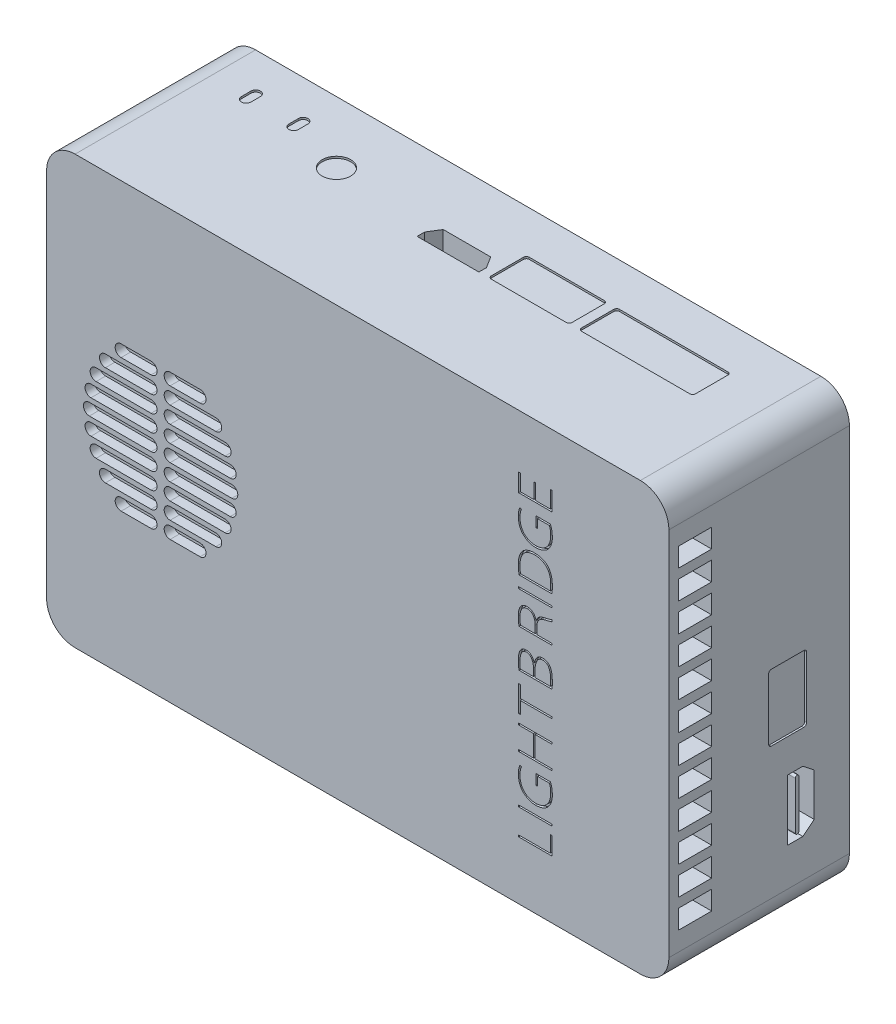
from build123d import *

# Parameters (mm, degrees)
MAIN_P_DEPTH         = 9.5
N3_LED_P_START       = -0.3
N3_LED_P_OUTLINE_W   = 3.5
N3_LED_P_OUTLINE_H   = 0.176423458
N3_LED_P_OUTLINE_H_2 = 0.176423459
N3_LED_P_DEPTH       = 0.3
CUT_EXTRUDE_1_DEPTH  = 1
ANTENNA_R            = 1.75
ANTENNA_R_2          = 1.25
CUT_EXTRUDE_2_DEPTH  = 0.2
SKETCH_7_3_R         = 1.25
CUT_EXTRUDE_3_DEPTH  = 3
AIT_TUBE_W           = 3.5
AIT_TUBE_H           = 2
CUT_EXTRUDE_4_DEPTH  = 40
CUT_EXTRUDE_START    = -5
CUT_EXTRUDE_5_DEPTH  = 5
CUT_EXTRUDE_START_2  = -0.2
CUT_EXTRUDE_6_DEPTH  = 0.2
CUT_EXTRUDE_7_DEPTH  = 0.2
CUT_EXTRUDE_8_DEPTH  = 5
SKETCH_10_6_R        = 1.5
CUT_EXTRUDE_9_DEPTH  = 0.2


# Read off the part's stored shape, not the designer's step: N3_LED_P, 切除-拉伸5, 切除-拉伸6
with BuildPart() as part:
    # Main → Main_P (new, symmetric)
    with BuildSketch(Plane.XY):
        with BuildLine():
            Line((-32.75, 19.5), (-32.75, -19.5))
            ThreePointArc((-32.75, -19.5), (-31.871320344, -21.621320344), (-29.75, -22.5))
            Line((-29.75, -22.5), (29.75, -22.5))
            ThreePointArc((29.75, -22.5), (31.871320344, -21.621320344), (32.75, -19.5))
            Line((32.75, -19.5), (32.75, 19.5))
            ThreePointArc((32.75, 19.5), (31.871320344, 21.621320344), (29.75, 22.5))
            Line((29.75, 22.5), (-29.75, 22.5))
            ThreePointArc((-29.75, 22.5), (-31.871320344, 21.621320344), (-32.75, 19.5))
        make_face()
    extrude(amount=MAIN_P_DEPTH, both=True)

    # N3_LED_P outline → N3_LED_P (cut)
    # profile 1 of 11: a face of its own
    with BuildSketch(Plane.XY.offset(9.5).offset(N3_LED_P_START)):
        with BuildLine():
            add(Edge.make_bspline(
                [(20.001928554, 11.353160073), (20.043677538, 11.401957467), (20.12563917, 11.49775654), (20.230328225, 11.652385483), (20.314454199, 11.813297479), (20.380551722, 11.979569559), (20.428182555, 12.151098568), (20.46286017, 12.327033268), (20.482093262, 12.508005578), (20.483996653, 12.630285047), (20.484957009, 12.691981212)],
                knots=[0, 0, 0, 0, 0.131993441, 0.259129603, 0.383023191, 0.504727587, 0.626369442, 0.74859247, 0.87315221, 1, 1, 1, 1], degree=3))
            add(Edge.make_bspline(
                [(20.484957009, 12.691981212), (20.483221419, 12.758407255), (20.479894688, 12.88573085), (20.465033479, 13.068364915), (20.442386428, 13.234608939), (20.409947285, 13.382873255), (20.375025678, 13.512615428), (20.341438151, 13.622348552), (20.30944645, 13.711816633), (20.285167186, 13.762758724), (20.274387903, 13.78537552)],
                knots=[0, 0, 0, 0, 0.17769931, 0.340609104, 0.489860893, 0.626074063, 0.7462279, 0.849140392, 0.933022753, 1, 1, 1, 1], degree=3))
            Line((20.274387903, 13.78537552), (18.764862846, 13.786086208))
            Line((18.764862846, 13.786086208), (18.764862846, 12.70724536))
            Line((18.764862846, 12.70724536), (18.93696313, 12.70724536))
            Line((18.93696313, 12.70724536), (18.93696313, 13.609662749))
            Line((18.93696313, 13.609662749), (20.162120829, 13.609662749))
            add(Edge.make_bspline(
                [(20.162120829, 13.609662749), (20.172968992, 13.587807743), (20.196033344, 13.541341665), (20.222888906, 13.463013366), (20.247444009, 13.373823335), (20.270783012, 13.272908982), (20.28856455, 13.159021643), (20.303067994, 13.031855972), (20.31114195, 12.891031731), (20.312699893, 12.792532479), (20.313513919, 12.741066577)],
                knots=[0, 0, 0, 0, 0.082268436, 0.174911484, 0.278790538, 0.394495802, 0.524216016, 0.667557628, 0.82629872, 1, 1, 1, 1], degree=3))
            add(Edge.make_bspline(
                [(20.313513919, 12.741066577), (20.311172733, 12.676025688), (20.306604605, 12.549117771), (20.283591235, 12.364763116), (20.248361465, 12.191385425), (20.199599452, 12.029435115), (20.136705205, 11.879082185), (20.060807254, 11.740161491), (19.972694476, 11.61185104), (19.870209155, 11.496580427), (19.757502163, 11.39341834), (19.634717877, 11.3041968), (19.504131774, 11.227066859), (19.363771462, 11.165849199), (19.215502641, 11.115633922), (19.057889011, 11.082039761), (18.89190718, 11.058754201), (18.778198859, 11.055860301), (18.720017985, 11.054379585)],
                knots=[0, 0, 0, 0, 0.074561748, 0.145485034, 0.21264214, 0.277120648, 0.339000405, 0.399080334, 0.458259166, 0.516984465, 0.575465895, 0.633030831, 0.690641939, 0.748920315, 0.808219462, 0.869738904, 0.933349605, 1, 1, 1, 1], degree=3))
            add(Edge.make_bspline(
                [(18.720017985, 11.054379585), (18.662564303, 11.055974297), (18.549864958, 11.059102432), (18.384882195, 11.080965701), (18.227139258, 11.115672362), (18.076628998, 11.164675482), (17.933733801, 11.228353392), (17.798466316, 11.305716064), (17.670473762, 11.396652963), (17.550262336, 11.500680316), (17.441096661, 11.618997269), (17.345405688, 11.750540535), (17.263752672, 11.894999648), (17.196188039, 12.052197812), (17.142866506, 12.222439761), (17.10440906, 12.405431718), (17.078183334, 12.600922274), (17.07299195, 12.73576381), (17.070322863, 12.805090968)],
                knots=[0, 0, 0, 0, 0.063634574, 0.124823592, 0.184029591, 0.242343714, 0.299846982, 0.357027756, 0.414680224, 0.473517376, 0.532818865, 0.592611097, 0.653311002, 0.716258734, 0.781807653, 0.850588601, 0.923181923, 1, 1, 1, 1], degree=3))
            add(Edge.make_bspline(
                [(17.070322863, 12.805090968), (17.071557095, 12.847797529), (17.073960056, 12.930944037), (17.084510663, 13.051662896), (17.097398235, 13.165247454), (17.115846778, 13.271442151), (17.139204532, 13.370258186), (17.166876303, 13.461533424), (17.198533841, 13.545462055), (17.224275507, 13.597283264), (17.236786277, 13.622469016)],
                knots=[0, 0, 0, 0, 0.152314901, 0.296545823, 0.431945517, 0.559836896, 0.680635867, 0.793779182, 0.899774116, 1, 1, 1, 1], degree=3))
            Line((17.236786277, 13.622469016), (17.070297158, 13.687117255))
            add(Edge.make_bspline(
                [(17.070297158, 13.687117255), (17.060682353, 13.668341971), (17.039152431, 13.626299475), (17.012719103, 13.552180293), (16.983759344, 13.46229129), (16.956985636, 13.356065448), (16.931500913, 13.236499357), (16.914762423, 13.104914464), (16.901992866, 12.963495151), (16.899939669, 12.86559042), (16.898879773, 12.815050317)],
                knots=[0, 0, 0, 0, 0.070576151, 0.158037419, 0.263017376, 0.386864239, 0.524695871, 0.672156233, 0.83076142, 1, 1, 1, 1], degree=3))
            add(Edge.make_bspline(
                [(16.898879773, 12.815050317), (16.900787459, 12.773541977), (16.904552145, 12.691628144), (16.914009265, 12.570974634), (16.929550617, 12.454588323), (16.947443923, 12.342433056), (16.970576764, 12.234794929), (16.996590342, 12.13139697), (17.027237712, 12.032384563), (17.062003974, 11.937574067), (17.101314246, 11.847260013), (17.143843841, 11.760822281), (17.190912566, 11.678869938), (17.242136167, 11.601098859), (17.297823848, 11.527946899), (17.356655239, 11.4585318), (17.420573873, 11.39432044), (17.509764088, 11.314890529), (17.625976171, 11.22488438), (17.770459251, 11.130733403), (17.918502801, 11.05126099), (18.06972369, 10.986047635), (18.22477805, 10.935891982), (18.383477834, 10.901340189), (18.545593567, 10.879645466), (18.654976492, 10.878049249), (18.710058635, 10.877245439)],
                knots=[0, 0, 0, 0, 0.041895112, 0.082677098, 0.121969993, 0.160253414, 0.197156967, 0.232935091, 0.267721705, 0.301609374, 0.334698209, 0.366988804, 0.398689845, 0.42992221, 0.460812283, 0.491334697, 0.521596622, 0.552074057, 0.611710228, 0.669602792, 0.725759705, 0.780917839, 0.835431765, 0.889786076, 0.944499389, 1, 1, 1, 1], degree=3))
            add(Edge.make_bspline(
                [(18.710058635, 10.877245439), (18.776529981, 10.878956607), (18.906810226, 10.882310404), (19.097626554, 10.906531586), (19.279572183, 10.944103057), (19.45097026, 10.998727853), (19.611511985, 11.065093131), (19.756750899, 11.147614955), (19.889050565, 11.241313601), (19.964453526, 11.316027504), (20.001928554, 11.353160073)],
                knots=[0, 0, 0, 0, 0.140972163, 0.27629782, 0.407409936, 0.534520343, 0.657372301, 0.775168028, 0.888259237, 1, 1, 1, 1], degree=3))
        make_face()
    # profile 2 of 11: a face of its own
    with BuildSketch(Plane.XY.offset(9.5).offset(N3_LED_P_START)):
        with BuildLine():
            add(Edge.make_bspline(
                [(17.460160261, 9.965253569), (17.437545455, 9.945440156), (17.392212587, 9.905722865), (17.329963143, 9.839824183), (17.271171926, 9.769997619), (17.217311893, 9.695124409), (17.167189919, 9.615901743), (17.121862726, 9.531868886), (17.080514957, 9.443516635), (17.043478914, 9.350330828), (17.010040201, 9.252866591), (16.981913851, 9.150310622), (16.956487096, 9.043699298), (16.937359854, 8.931904851), (16.920375029, 8.816005524), (16.909692746, 8.695333677), (16.901365894, 8.570104802), (16.899718753, 8.484881851), (16.898879773, 8.441473081)],
                knots=[0, 0, 0, 0, 0.053805333, 0.107856334, 0.162107056, 0.217137954, 0.27285245, 0.329844782, 0.387964543, 0.447409002, 0.509303087, 0.572345594, 0.637740232, 0.705447895, 0.775336706, 0.847408181, 0.922276534, 1, 1, 1, 1], degree=3))
            add(Edge.make_bspline(
                [(16.898879773, 8.441473081), (16.900608299, 8.354658739), (16.90394973, 8.186836994), (16.919215028, 7.944358849), (16.940611557, 7.719602383), (16.963831323, 7.576808855), (16.974997659, 7.508139748)],
                knots=[0, 0, 0, 0, 0.277855552, 0.537125578, 0.777404666, 1, 1, 1, 1], degree=3))
            Line((16.974997659, 7.508139748), (20.441563395, 7.508850435))
            add(Edge.make_bspline(
                [(20.441563395, 7.508850435), (20.449504706, 7.573528225), (20.465559536, 7.704286345), (20.478944939, 7.903965053), (20.486518437, 8.108722988), (20.485481531, 8.247022175), (20.484957009, 8.316981212)],
                knots=[0, 0, 0, 0, 0.241300813, 0.487834245, 0.740919499, 1, 1, 1, 1], degree=3))
            add(Edge.make_bspline(
                [(20.484957009, 8.316981212), (20.484392997, 8.362285585), (20.483281847, 8.451539022), (20.475038842, 8.582972045), (20.463336134, 8.709750123), (20.446249063, 8.831770749), (20.424124137, 8.948972371), (20.398049333, 9.061619276), (20.366842401, 9.169259311), (20.330267631, 9.271580199), (20.290525124, 9.369554961), (20.24656332, 9.462400912), (20.199012757, 9.550169061), (20.147246468, 9.632287153), (20.093002933, 9.710152171), (20.033457879, 9.781917072), (19.971066455, 9.849283539), (19.926111334, 9.890154463), (19.903757822, 9.910477146)],
                knots=[0, 0, 0, 0, 0.077753017, 0.153180001, 0.22595469, 0.296232891, 0.364561942, 0.430606773, 0.494618888, 0.556793227, 0.617029805, 0.676015949, 0.733021353, 0.788242289, 0.842557394, 0.895763282, 0.948169272, 1, 1, 1, 1], degree=3))
            add(Edge.make_bspline(
                [(19.903757822, 9.910477146), (19.853526049, 9.948337189), (19.754469389, 10.022996895), (19.595133586, 10.114278363), (19.43150942, 10.18799908), (19.26388407, 10.242108188), (19.095859551, 10.27990523), (18.930959065, 10.308664111), (18.769165571, 10.32385507), (18.662423525, 10.324764285), (18.609753757, 10.325212919)],
                knots=[0, 0, 0, 0, 0.136041375, 0.26827252, 0.396475576, 0.523892265, 0.648770483, 0.769014316, 0.886024647, 1, 1, 1, 1], degree=3))
            add(Edge.make_bspline(
                [(18.609753757, 10.325212919), (18.55424153, 10.324807738), (18.444896256, 10.324009633), (18.284144644, 10.309443328), (18.130297023, 10.280797202), (17.982461705, 10.243447473), (17.841709078, 10.191197231), (17.706996901, 10.129128006), (17.579053192, 10.053929664), (17.499955093, 9.994934478), (17.460160261, 9.965253569)],
                knots=[0, 0, 0, 0, 0.135479044, 0.266860004, 0.393341106, 0.517170538, 0.638578994, 0.759256684, 0.878880278, 1, 1, 1, 1], degree=3))
        make_face()
        with BuildLine():
            Line((20.277944814, 7.685273894), (17.135152421, 7.685273894))
            add(Edge.make_bspline(
                [(17.135152421, 7.685273894), (17.13043166, 7.707766445), (17.120529303, 7.754947243), (17.108829952, 7.829529957), (17.098155655, 7.910887335), (17.088834836, 7.99886843), (17.081992991, 8.093788252), (17.076386189, 8.19529423), (17.071871738, 8.303666312), (17.070849899, 8.37815535), (17.070322863, 8.416574707)],
                knots=[0, 0, 0, 0, 0.093749641, 0.196651009, 0.307886971, 0.428503945, 0.55753339, 0.696090129, 0.843251811, 1, 1, 1, 1], degree=3))
            add(Edge.make_bspline(
                [(17.070322863, 8.416574707), (17.07261469, 8.490860449), (17.07704069, 8.634321824), (17.100144563, 8.841368845), (17.134721962, 9.032676991), (17.184018713, 9.207561616), (17.244629694, 9.367147881), (17.319900479, 9.510056284), (17.40642546, 9.638524337), (17.508148413, 9.748847751), (17.618834296, 9.845446488), (17.738296598, 9.927993396), (17.865119629, 9.998492465), (17.999889296, 10.055366461), (18.142728077, 10.098977024), (18.293077165, 10.129069025), (18.451353655, 10.147643395), (18.559429775, 10.148401979), (18.614733432, 10.148790155)],
                knots=[0, 0, 0, 0, 0.084293615, 0.16278868, 0.236135431, 0.304614354, 0.368666143, 0.429438748, 0.487496489, 0.543870415, 0.599170997, 0.6538761, 0.708307954, 0.763524048, 0.8195218, 0.877455983, 0.937292973, 1, 1, 1, 1], degree=3))
            add(Edge.make_bspline(
                [(18.614733432, 10.148790155), (18.674305432, 10.148154534), (18.790913855, 10.146910347), (18.961991736, 10.127711311), (19.12531683, 10.09647265), (19.280350185, 10.049554731), (19.427952657, 9.990725294), (19.567465657, 9.917039473), (19.698462069, 9.828839305), (19.80134184, 9.745673839), (19.87827063, 9.671991283), (19.932393491, 9.612027124), (19.983023896, 9.547866977), (20.029803588, 9.479500065), (20.073461435, 9.407398385), (20.113280382, 9.331092016), (20.149556717, 9.250552591), (20.182292952, 9.16575802), (20.211214644, 9.076881996), (20.237209219, 8.984203185), (20.25799903, 8.887122811), (20.276781333, 8.786134394), (20.291502831, 8.680734525), (20.303067283, 8.571378214), (20.309848977, 8.457904175), (20.312277811, 8.381012267), (20.313513919, 8.341879585)],
                knots=[0, 0, 0, 0, 0.063336, 0.123976215, 0.182843069, 0.239981199, 0.296001009, 0.351627041, 0.407453443, 0.463747994, 0.492111995, 0.520684957, 0.549599897, 0.578985189, 0.608746969, 0.639209171, 0.670480405, 0.702661089, 0.735843385, 0.769868222, 0.804997091, 0.841410132, 0.879115073, 0.918168596, 0.958353455, 1, 1, 1, 1], degree=3))
            add(Edge.make_bspline(
                [(20.313513919, 8.341879585), (20.313635287, 8.277377607), (20.313866032, 8.154745847), (20.308670201, 7.980548835), (20.297184746, 7.825958127), (20.284067323, 7.730042267), (20.277944814, 7.685273894)],
                knots=[0, 0, 0, 0, 0.293955934, 0.558871746, 0.79410502, 1, 1, 1, 1], degree=3))
        make_face(mode=Mode.SUBTRACT)
    # profile 3 of 11: a face of its own
    with BuildSketch(Plane.XY.offset(9.5).offset(N3_LED_P_START)):
        with BuildLine():
            add(Edge.make_bspline(
                [(17.212599285, 4.802042187), (17.187625628, 4.772275863), (17.136691876, 4.711567472), (17.073473378, 4.606984446), (17.020766587, 4.490291562), (16.975081885, 4.361580854), (16.940615046, 4.217816664), (16.916257823, 4.05768591), (16.901437045, 3.880606736), (16.899756035, 3.756815107), (16.898879773, 3.69228609)],
                knots=[0, 0, 0, 0, 0.098739236, 0.201378586, 0.309623397, 0.424103807, 0.548328424, 0.685103007, 0.835853249, 1, 1, 1, 1], degree=3))
            add(Edge.make_bspline(
                [(16.898879773, 3.69228609), (16.89983384, 3.618513319), (16.901793072, 3.467016728), (16.915456659, 3.277329942), (16.930101181, 3.125146498), (16.943839781, 3.016811747), (16.958122177, 2.915089106), (16.97092094, 2.850198411), (16.977131806, 2.818708854)],
                knots=[0, 0, 0, 0, 0.251956012, 0.517406042, 0.649255179, 0.774128295, 0.890391064, 1, 1, 1, 1], degree=3))
            Line((16.977131806, 2.818708854), (20.441563395, 2.819419541))
            Line((20.441563395, 2.819419541), (20.441563395, 2.995843))
            Line((20.441563395, 2.995843), (18.84590622, 2.995843))
            Line((18.84590622, 2.995843), (18.84590622, 3.778137545))
            add(Edge.make_bspline(
                [(18.84590622, 3.778137545), (18.848144559, 3.810969691), (18.852499981, 3.874855388), (18.865190564, 3.967933453), (18.883968646, 4.055223656), (18.906206265, 4.137551711), (18.934863512, 4.214196677), (18.968900342, 4.285015557), (19.007577127, 4.35073499), (19.051870043, 4.410863585), (19.102161479, 4.465645789), (19.157201565, 4.51686745), (19.219028009, 4.563031755), (19.286204281, 4.605639172), (19.359727665, 4.643443786), (19.438597346, 4.677496676), (19.523431255, 4.707551967), (19.582568577, 4.723474806), (19.612802537, 4.731615358)],
                knots=[0, 0, 0, 0, 0.074062976, 0.144113783, 0.211217007, 0.274931514, 0.335904118, 0.395110606, 0.451590903, 0.507317097, 0.5628615, 0.618766345, 0.676306084, 0.73627992, 0.79763448, 0.862184157, 0.929541641, 1, 1, 1, 1], degree=3))
            add(Edge.make_bspline(
                [(19.612802537, 4.731615358), (19.664251153, 4.744925744), (19.762860468, 4.77043718), (19.90402436, 4.806432652), (20.031746019, 4.839508733), (20.145539132, 4.868098425), (20.244118448, 4.894080913), (20.325982987, 4.917710101), (20.390356802, 4.940107417), (20.426694198, 4.956000351), (20.442274082, 4.962814545)],
                knots=[0, 0, 0, 0, 0.184989652, 0.354561589, 0.507116897, 0.644254874, 0.762986854, 0.86197473, 0.940820809, 1, 1, 1, 1], degree=3))
            Line((20.442274082, 4.962814545), (20.441563395, 5.17738587))
            add(Edge.make_bspline(
                [(20.441563395, 5.17738587), (20.422821668, 5.16567292), (20.381472594, 5.139831137), (20.30801055, 5.107421461), (20.219991431, 5.075098545), (20.136499438, 5.049329918), (20.061315515, 5.028353173), (19.997277776, 5.011310392), (19.927342012, 4.993441442), (19.851418512, 4.975106312), (19.769623997, 4.955826271), (19.68199913, 4.936216652), (19.588800768, 4.914316951), (19.52438413, 4.900788724), (19.491156196, 4.89381048)],
                knots=[0, 0, 0, 0, 0.066505769, 0.146728843, 0.241202307, 0.348969302, 0.409803661, 0.476338617, 0.548583434, 0.627239274, 0.711619263, 0.80172784, 0.897725578, 1, 1, 1, 1], degree=3))
            add(Edge.make_bspline(
                [(19.491156196, 4.89381048), (19.448361585, 4.882042936), (19.364662665, 4.859027637), (19.246876812, 4.807418712), (19.138945359, 4.744705486), (19.040818159, 4.670817803), (18.954916311, 4.584822585), (18.881651523, 4.488197948), (18.822253559, 4.379988206), (18.794592112, 4.301917351), (18.780485464, 4.262103163)],
                knots=[0, 0, 0, 0, 0.133527676, 0.261157235, 0.38597439, 0.508814444, 0.63001384, 0.750852889, 0.872941188, 1, 1, 1, 1], degree=3))
            Line((18.780485464, 4.262103163), (18.769981463, 4.262655456))
            add(Edge.make_bspline(
                [(18.769981463, 4.262655456), (18.761027575, 4.293170365), (18.74345334, 4.353063478), (18.711622073, 4.439398868), (18.674315106, 4.519649939), (18.633910179, 4.595186504), (18.588237935, 4.66457154), (18.539212374, 4.729152708), (18.485406536, 4.787715641), (18.427793552, 4.841244702), (18.366151183, 4.889072229), (18.300010992, 4.9296597), (18.23075703, 4.964597893), (18.158164273, 4.994148704), (18.081535626, 5.016050481), (18.001289772, 5.031484927), (17.917606516, 5.041817944), (17.86046223, 5.043207755), (17.831501724, 5.043912106)],
                knots=[0, 0, 0, 0, 0.072009785, 0.141337147, 0.208137114, 0.272296741, 0.335153107, 0.396054377, 0.455731089, 0.515012642, 0.57398203, 0.632101689, 0.690461508, 0.749496881, 0.809320802, 0.870616199, 0.934428783, 1, 1, 1, 1], degree=3))
            add(Edge.make_bspline(
                [(17.831501724, 5.043912106), (17.802061141, 5.043027437), (17.743409139, 5.041264985), (17.65636577, 5.029049793), (17.571013602, 5.007968633), (17.488189846, 4.979901336), (17.409097888, 4.945389652), (17.336549789, 4.903955974), (17.269983824, 4.857288229), (17.231607763, 4.820342293), (17.212599285, 4.802042187)],
                knots=[0, 0, 0, 0, 0.129665634, 0.258321951, 0.386251234, 0.51638716, 0.643116972, 0.765671911, 0.883932326, 1, 1, 1, 1], degree=3))
        make_face()
        with BuildLine():
            Line((18.673805935, 2.995843), (17.126188589, 2.995843))
            add(Edge.make_bspline(
                [(17.126188589, 2.995843), (17.12283464, 3.011941238), (17.115368871, 3.047775328), (17.106562438, 3.107905667), (17.097489521, 3.179307394), (17.088002585, 3.261772696), (17.080404737, 3.353816073), (17.074773494, 3.45462895), (17.071236977, 3.563026974), (17.070633883, 3.637981178), (17.070322863, 3.676635683)],
                knots=[0, 0, 0, 0, 0.072096357, 0.160483868, 0.266375431, 0.387753503, 0.524453649, 0.671308738, 0.830491191, 1, 1, 1, 1], degree=3))
            add(Edge.make_bspline(
                [(17.070322863, 3.676635683), (17.070307134, 3.717673099), (17.070276281, 3.798171178), (17.078539225, 3.916172175), (17.091617555, 4.029074531), (17.111709237, 4.136650515), (17.137260386, 4.239306328), (17.168342911, 4.337197862), (17.206195755, 4.429590412), (17.24915626, 4.516761816), (17.298991175, 4.59642561), (17.357203624, 4.666776699), (17.424004302, 4.72590458), (17.49800565, 4.776064343), (17.580842719, 4.814292547), (17.67121319, 4.842683015), (17.769367417, 4.861432998), (17.837583126, 4.865428742), (17.872761887, 4.867489342)],
                knots=[0, 0, 0, 0, 0.076016147, 0.14911158, 0.21903223, 0.286508128, 0.351724659, 0.414946676, 0.476629326, 0.536559504, 0.594823722, 0.650348034, 0.705116212, 0.759587503, 0.815408289, 0.873491651, 0.934759793, 1, 1, 1, 1], degree=3))
            add(Edge.make_bspline(
                [(17.872761887, 4.867489342), (17.902470934, 4.866296421), (17.960841373, 4.863952646), (18.045742631, 4.84847438), (18.126317353, 4.825128733), (18.202184806, 4.792290974), (18.272950216, 4.749894386), (18.338845676, 4.699021713), (18.39979725, 4.63921599), (18.455788588, 4.570981433), (18.506085306, 4.494823343), (18.550446264, 4.411738758), (18.587981117, 4.322170862), (18.618608582, 4.22594495), (18.642715632, 4.123177503), (18.660083431, 4.013803281), (18.671969372, 3.897892959), (18.67363404, 3.818468784), (18.674489529, 3.777651943)],
                knots=[0, 0, 0, 0, 0.05882685, 0.115579237, 0.170416235, 0.224685148, 0.278811617, 0.333390577, 0.389186571, 0.447576851, 0.507886707, 0.569660036, 0.633858482, 0.699952991, 0.76944273, 0.842716269, 0.919170389, 1, 1, 1, 1], degree=3))
            Line((18.674489529, 3.777651943), (18.673805935, 2.995843))
        make_face(mode=Mode.SUBTRACT)
    # profile 4 of 11: a face of its own
    with BuildSketch(Plane.XY.offset(9.5).offset(N3_LED_P_START)):
        with BuildLine():
            add(Edge.make_bspline(
                [(17.204774082, 0.831107228), (17.179449628, 0.800693982), (17.127488691, 0.738291816), (17.064888706, 0.629382361), (17.012295441, 0.507522876), (16.969518728, 0.371642007), (16.937351447, 0.220345362), (16.914171194, 0.052758913), (16.900961341, -0.131889498), (16.899593262, -0.260605439), (16.898879773, -0.327734236)],
                knots=[0, 0, 0, 0, 0.096793117, 0.198600969, 0.306293158, 0.421470967, 0.546906863, 0.684743517, 0.835585334, 1, 1, 1, 1], degree=3))
            add(Edge.make_bspline(
                [(16.898879773, -0.327734236), (16.899737151, -0.407437918), (16.901410113, -0.562959995), (16.91475775, -0.754063488), (16.928526412, -0.899430751), (16.942481357, -1.000841743), (16.956914524, -1.096564382), (16.96908323, -1.157956452), (16.974997659, -1.187795211)],
                knots=[0, 0, 0, 0, 0.276452091, 0.539428065, 0.664251355, 0.782916292, 0.894489489, 1, 1, 1, 1], degree=3))
            Line((16.974997659, -1.187795211), (20.441563395, -1.187084524))
            add(Edge.make_bspline(
                [(20.441563395, -1.187084524), (20.444818717, -1.166239908), (20.451755594, -1.121821414), (20.459054887, -1.050558717), (20.466265994, -0.970885104), (20.472356816, -0.883354225), (20.478549679, -0.788776597), (20.481391477, -0.687699676), (20.48485385, -0.580534156), (20.48492204, -0.507006016), (20.484957009, -0.469299276)],
                knots=[0, 0, 0, 0, 0.087925793, 0.187364028, 0.298507494, 0.421394028, 0.55309154, 0.693534216, 0.842838051, 1, 1, 1, 1], degree=3))
            add(Edge.make_bspline(
                [(20.484957009, -0.469299276), (20.484369307, -0.392917151), (20.483232813, -0.2452098), (20.468035348, -0.031959213), (20.443682769, 0.1653112), (20.408835065, 0.346557912), (20.361653084, 0.511969792), (20.301275053, 0.660748801), (20.22843065, 0.794038193), (20.167586369, 0.870982793), (20.137802537, 0.908647878)],
                knots=[0, 0, 0, 0, 0.158013033, 0.305564772, 0.442065492, 0.569079291, 0.687087803, 0.797333092, 0.900792694, 1, 1, 1, 1], degree=3))
            add(Edge.make_bspline(
                [(20.137802537, 0.908647878), (20.116901393, 0.929302321), (20.075401338, 0.97031254), (20.005326724, 1.022991847), (19.930666562, 1.069090363), (19.849677534, 1.10583216), (19.763907181, 1.135154905), (19.672883103, 1.156405523), (19.576450797, 1.170161297), (19.510173129, 1.17269521), (19.476217172, 1.173993407)],
                knots=[0, 0, 0, 0, 0.120186609, 0.238635298, 0.35801929, 0.478784851, 0.601900247, 0.728592604, 0.86095018, 1, 1, 1, 1], degree=3))
            add(Edge.make_bspline(
                [(19.476217172, 1.173993407), (19.440099641, 1.171086), (19.369802242, 1.165427165), (19.268347115, 1.14637857), (19.174641309, 1.117528874), (19.087929698, 1.081600018), (19.009001809, 1.036493066), (18.937674179, 0.982546923), (18.874177587, 0.919751186), (18.819531715, 0.849073309), (18.771463477, 0.775716448), (18.728180091, 0.703111272), (18.689246818, 0.632742475), (18.656659949, 0.563439295), (18.628455471, 0.495986955), (18.606767649, 0.429730005), (18.588855345, 0.365547743), (18.581873219, 0.322786179), (18.578452944, 0.301838935)],
                knots=[0, 0, 0, 0, 0.079766609, 0.155253836, 0.226785951, 0.29536112, 0.361562569, 0.426425973, 0.49178992, 0.557611254, 0.622791348, 0.684859283, 0.743752517, 0.799817738, 0.853448869, 0.904644719, 0.953289118, 1, 1, 1, 1], degree=3))
            Line((18.578452944, 0.301838935), (18.562559389, 0.302139049))
            add(Edge.make_bspline(
                [(18.562559389, 0.302139049), (18.554720314, 0.329196774), (18.539193495, 0.382789884), (18.509726335, 0.459613072), (18.477824614, 0.533060341), (18.441615987, 0.601593636), (18.40214744, 0.666193184), (18.359858602, 0.726722013), (18.313024881, 0.782467131), (18.263563511, 0.834256213), (18.211191979, 0.881458713), (18.155683947, 0.921889149), (18.097930777, 0.956337042), (18.038599092, 0.985977187), (17.976034549, 1.007691732), (17.911644339, 1.024466812), (17.84483323, 1.034305262), (17.799518821, 1.036369641), (17.776725302, 1.037408041)],
                knots=[0, 0, 0, 0, 0.072964773, 0.144520987, 0.213023038, 0.280360538, 0.345169563, 0.409098788, 0.471485738, 0.533630148, 0.594556674, 0.653916978, 0.711242092, 0.768675773, 0.825425006, 0.882502608, 0.940897848, 1, 1, 1, 1], degree=3))
            add(Edge.make_bspline(
                [(17.776725302, 1.037408041), (17.748016013, 1.037442453), (17.691640673, 1.037510028), (17.609171906, 1.028971575), (17.530994752, 1.01290647), (17.456594608, 0.991693766), (17.387468348, 0.960667216), (17.32124119, 0.925848041), (17.260486632, 0.881680637), (17.223443184, 0.848054219), (17.204774082, 0.831107228)],
                knots=[0, 0, 0, 0, 0.137723552, 0.270442515, 0.396992059, 0.520496014, 0.640791249, 0.759956062, 0.879023018, 1, 1, 1, 1], degree=3))
        make_face()
        with BuildLine():
            Line((18.491692114, -1.010661065), (17.110046329, -1.010661065))
            add(Edge.make_bspline(
                [(17.110046329, -1.010661065), (17.107052247, -0.995752525), (17.100385166, -0.962554893), (17.093944946, -0.906876719), (17.087581796, -0.840947677), (17.081785538, -0.764588753), (17.077866418, -0.67775467), (17.074348228, -0.580528237), (17.071311795, -0.472872813), (17.070662714, -0.3976891), (17.070322863, -0.358323667)],
                knots=[0, 0, 0, 0, 0.069693875, 0.155191031, 0.256774737, 0.373431838, 0.506232837, 0.65528097, 0.819508591, 1, 1, 1, 1], degree=3))
            add(Edge.make_bspline(
                [(17.070322863, -0.358323667), (17.070185204, -0.317530318), (17.069915335, -0.237558509), (17.075885432, -0.119836187), (17.086067266, -0.00650466), (17.102886233, 0.102098205), (17.122909174, 0.206581749), (17.149780686, 0.30608216), (17.179799446, 0.401700192), (17.215888475, 0.491820297), (17.25728382, 0.575250323), (17.308612358, 0.6481534), (17.367467895, 0.710740598), (17.434111592, 0.763667465), (17.509956511, 0.80431928), (17.593478875, 0.833993755), (17.684517563, 0.8544632), (17.748158932, 0.858765552), (17.780993594, 0.860985277)],
                knots=[0, 0, 0, 0, 0.077231753, 0.151406131, 0.223116388, 0.292587466, 0.359424255, 0.424444554, 0.487634434, 0.549085439, 0.608125261, 0.663559882, 0.717241031, 0.770327351, 0.823972808, 0.879367408, 0.937761704, 1, 1, 1, 1], degree=3))
            add(Edge.make_bspline(
                [(17.780993594, 0.860985277), (17.805717913, 0.859695525), (17.854615011, 0.857144792), (17.926249311, 0.842751171), (17.99428744, 0.818974705), (18.059210423, 0.786641761), (18.120462102, 0.744767095), (18.179328308, 0.694841495), (18.233877684, 0.634990523), (18.285867448, 0.567780271), (18.332645862, 0.492149994), (18.373922876, 0.409567664), (18.40874964, 0.319923081), (18.437678008, 0.223778493), (18.461326719, 0.120927537), (18.478137262, 0.011079278), (18.488725837, -0.105587941), (18.491138948, -0.185673024), (18.492375708, -0.226717975)],
                knots=[0, 0, 0, 0, 0.051551084, 0.101952184, 0.151655438, 0.201385714, 0.25265172, 0.305936252, 0.361890554, 0.421102566, 0.482815226, 0.546912026, 0.613266931, 0.682996238, 0.756009286, 0.833038415, 0.91442938, 1, 1, 1, 1], degree=3))
            Line((18.492375708, -0.226717975), (18.491692114, -1.010661065))
        make_face(mode=Mode.SUBTRACT)
        with BuildLine():
            Line((18.663792399, -1.010661065), (18.663792399, -0.337646345))
            add(Edge.make_bspline(
                [(18.663792399, -0.337646345), (18.66396341, -0.293536796), (18.664300384, -0.206619829), (18.674236895, -0.078702804), (18.688702557, 0.044607266), (18.710087827, 0.163163316), (18.737955003, 0.276852183), (18.771027199, 0.386460774), (18.811992204, 0.490730992), (18.857398237, 0.590316557), (18.909869048, 0.681887046), (18.970756028, 0.762784582), (19.039581155, 0.831269876), (19.114949715, 0.88970262), (19.199022833, 0.934179543), (19.289834803, 0.968000762), (19.38792895, 0.99054413), (19.456178492, 0.995189766), (19.491156196, 0.997570642)],
                knots=[0, 0, 0, 0, 0.075616643, 0.149001053, 0.219864781, 0.288459159, 0.355425173, 0.420509169, 0.484620485, 0.54738556, 0.608062364, 0.665235755, 0.720441952, 0.774118922, 0.828153573, 0.882837646, 0.939954614, 1, 1, 1, 1], degree=3))
            add(Edge.make_bspline(
                [(19.491156196, 0.997570642), (19.529467188, 0.99451644), (19.603482742, 0.988615823), (19.709546765, 0.963986587), (19.806275523, 0.927240216), (19.893595841, 0.877241748), (19.972243147, 0.815827271), (20.04014253, 0.740498004), (20.099143403, 0.653406033), (20.147056599, 0.55450302), (20.186872191, 0.448280591), (20.224008001, 0.338512888), (20.253575169, 0.224826706), (20.276799473, 0.107392445), (20.295639051, -0.013107501), (20.307341962, -0.137348904), (20.314051876, -0.264818363), (20.313694803, -0.350964605), (20.313513919, -0.394604154)],
                knots=[0, 0, 0, 0, 0.063648576, 0.122966919, 0.179842969, 0.23460486, 0.28919006, 0.344568021, 0.402033447, 0.463043508, 0.526270574, 0.590048938, 0.655083613, 0.720852099, 0.788464273, 0.857197603, 0.927659847, 1, 1, 1, 1], degree=3))
            add(Edge.make_bspline(
                [(20.313513919, -0.394604154), (20.313298975, -0.454363631), (20.312882651, -0.570111183), (20.308802073, -0.711698854), (20.303496376, -0.817024501), (20.297111929, -0.887743167), (20.288776623, -0.951591101), (20.281418812, -0.991716035), (20.277944814, -1.010661065)],
                knots=[0, 0, 0, 0, 0.2900987, 0.561889358, 0.68755456, 0.801988273, 0.906508552, 1, 1, 1, 1], degree=3))
            Line((20.277944814, -1.010661065), (18.663792399, -1.010661065))
        make_face(mode=Mode.SUBTRACT)
    # profile 5 of 11: a face of its own
    with BuildSketch(Plane.XY.offset(9.5).offset(N3_LED_P_START)):
        with BuildLine():
            add(Edge.make_bspline(
                [(20.001928554, -12.139522854), (20.043677538, -12.09072546), (20.12563917, -11.994926387), (20.230328225, -11.840297444), (20.314454199, -11.679385448), (20.380551722, -11.513113368), (20.428182555, -11.341584359), (20.46286017, -11.165649659), (20.482093262, -10.984677349), (20.483996653, -10.86239788), (20.484957009, -10.800701715)],
                knots=[0, 0, 0, 0, 0.131993441, 0.259129603, 0.383023191, 0.504727587, 0.626369442, 0.74859247, 0.87315221, 1, 1, 1, 1], degree=3))
            add(Edge.make_bspline(
                [(20.484957009, -10.800701715), (20.483221419, -10.734275672), (20.479894688, -10.606952077), (20.465033479, -10.424318012), (20.442386428, -10.258073988), (20.409947285, -10.109809672), (20.375025678, -9.980067498), (20.341438151, -9.870334375), (20.30944645, -9.780866293), (20.285167186, -9.729924203), (20.274387903, -9.707307406)],
                knots=[0, 0, 0, 0, 0.17769931, 0.340609104, 0.489860893, 0.626074063, 0.7462279, 0.849140392, 0.933022753, 1, 1, 1, 1], degree=3))
            Line((20.274387903, -9.707307406), (18.764862846, -9.706596719))
            Line((18.764862846, -9.706596719), (18.764862846, -10.785437567))
            Line((18.764862846, -10.785437567), (18.93696313, -10.785437567))
            Line((18.93696313, -10.785437567), (18.93696313, -9.883020178))
            Line((18.93696313, -9.883020178), (20.162120829, -9.883020178))
            add(Edge.make_bspline(
                [(20.162120829, -9.883020178), (20.172968992, -9.904875184), (20.196033344, -9.951341262), (20.222888906, -10.029669561), (20.247444009, -10.118859592), (20.270783012, -10.219773945), (20.28856455, -10.333661284), (20.303067994, -10.460826955), (20.31114195, -10.601651196), (20.312699893, -10.700150448), (20.313513919, -10.751616349)],
                knots=[0, 0, 0, 0, 0.082268436, 0.174911484, 0.278790538, 0.394495802, 0.524216016, 0.667557628, 0.82629872, 1, 1, 1, 1], degree=3))
            add(Edge.make_bspline(
                [(20.313513919, -10.751616349), (20.311172733, -10.816657239), (20.306604605, -10.943565156), (20.283591235, -11.127919811), (20.248361465, -11.301297502), (20.199599452, -11.463247812), (20.136705205, -11.613600741), (20.060807254, -11.752521436), (19.972694476, -11.880831887), (19.870209155, -11.9961025), (19.757502163, -12.099264587), (19.634717877, -12.188486127), (19.504131774, -12.265616068), (19.363771462, -12.326833728), (19.215502641, -12.377049004), (19.057889011, -12.410643166), (18.89190718, -12.433928726), (18.778198859, -12.436822626), (18.720017985, -12.438303341)],
                knots=[0, 0, 0, 0, 0.074561748, 0.145485034, 0.21264214, 0.277120648, 0.339000405, 0.399080334, 0.458259166, 0.516984465, 0.575465895, 0.633030831, 0.690641939, 0.748920315, 0.808219462, 0.869738904, 0.933349605, 1, 1, 1, 1], degree=3))
            add(Edge.make_bspline(
                [(18.720017985, -12.438303341), (18.662564303, -12.43670863), (18.549864958, -12.433580495), (18.384882195, -12.411717225), (18.227139258, -12.377010564), (18.076628998, -12.328007445), (17.933733801, -12.264329535), (17.798466316, -12.186966863), (17.670473762, -12.096029964), (17.550262336, -11.992002611), (17.441096661, -11.873685657), (17.345405688, -11.742142392), (17.263752672, -11.597683279), (17.196188039, -11.440485115), (17.142866506, -11.270243165), (17.10440906, -11.087251209), (17.078183334, -10.891760653), (17.07299195, -10.756919116), (17.070322863, -10.687591959)],
                knots=[0, 0, 0, 0, 0.063634574, 0.124823592, 0.184029591, 0.242343714, 0.299846982, 0.357027756, 0.414680224, 0.473517376, 0.532818865, 0.592611097, 0.653311002, 0.716258734, 0.781807653, 0.850588601, 0.923181923, 1, 1, 1, 1], degree=3))
            add(Edge.make_bspline(
                [(17.070322863, -10.687591959), (17.071557095, -10.644885398), (17.073960056, -10.56173889), (17.084510663, -10.441020031), (17.097398235, -10.327435473), (17.115846778, -10.221240776), (17.139204532, -10.122424741), (17.166876303, -10.031149503), (17.198533841, -9.947220872), (17.224275507, -9.895399663), (17.236786277, -9.87021391)],
                knots=[0, 0, 0, 0, 0.152314901, 0.296545823, 0.431945517, 0.559836896, 0.680635867, 0.793779182, 0.899774116, 1, 1, 1, 1], degree=3))
            Line((17.236786277, -9.87021391), (17.070297158, -9.805565671))
            add(Edge.make_bspline(
                [(17.070297158, -9.805565671), (17.060682353, -9.824340956), (17.039152431, -9.866383452), (17.012719103, -9.940502634), (16.983759344, -10.030391637), (16.956985636, -10.136617479), (16.931500913, -10.25618357), (16.914762423, -10.387768463), (16.901992866, -10.529187776), (16.899939669, -10.627092507), (16.898879773, -10.67763261)],
                knots=[0, 0, 0, 0, 0.070576151, 0.158037419, 0.263017376, 0.386864239, 0.524695871, 0.672156233, 0.83076142, 1, 1, 1, 1], degree=3))
            add(Edge.make_bspline(
                [(16.898879773, -10.67763261), (16.900787459, -10.71914095), (16.904552145, -10.801054783), (16.914009265, -10.921708293), (16.929550617, -11.038094604), (16.947443923, -11.150249871), (16.970576764, -11.257887998), (16.996590342, -11.361285956), (17.027237712, -11.460298363), (17.062003974, -11.55510886), (17.101314246, -11.645422914), (17.143843841, -11.731860646), (17.190912566, -11.813812989), (17.242136167, -11.891584068), (17.297823848, -11.964736027), (17.356655239, -12.034151127), (17.420573873, -12.098362487), (17.509764088, -12.177792398), (17.625976171, -12.267798547), (17.770459251, -12.361949524), (17.918502801, -12.441421937), (18.06972369, -12.506635292), (18.22477805, -12.556790945), (18.383477834, -12.591342738), (18.545593567, -12.61303746), (18.654976492, -12.614633678), (18.710058635, -12.615437488)],
                knots=[0, 0, 0, 0, 0.041895112, 0.082677098, 0.121969993, 0.160253414, 0.197156967, 0.232935091, 0.267721705, 0.301609374, 0.334698209, 0.366988804, 0.398689845, 0.42992221, 0.460812283, 0.491334697, 0.521596622, 0.552074057, 0.611710228, 0.669602792, 0.725759705, 0.780917839, 0.835431765, 0.889786076, 0.944499389, 1, 1, 1, 1], degree=3))
            add(Edge.make_bspline(
                [(18.710058635, -12.615437488), (18.776529981, -12.61372632), (18.906810226, -12.610372523), (19.097626554, -12.586151341), (19.279572183, -12.54857987), (19.45097026, -12.493955073), (19.611511985, -12.427589795), (19.756750899, -12.345067972), (19.889050565, -12.251369326), (19.964453526, -12.176655422), (20.001928554, -12.139522854)],
                knots=[0, 0, 0, 0, 0.140972163, 0.27629782, 0.407409936, 0.534520343, 0.657372301, 0.775168028, 0.888259237, 1, 1, 1, 1], degree=3))
        make_face()
    # profile 6 of 11: a face of its own
    with BuildSketch(Plane.XY.offset(9.5).offset(N3_LED_P_START)):
        Polygon((18.709320854, 15.151940561), (18.709320854, 16.774600384), (18.53722057, 16.774600384), (18.53722057, 15.151940561), (17.115825614, 15.151940561), (17.115825614, 16.863109101), (16.943725329, 16.863109101), (16.943725329, 14.975517102), (20.43940146, 14.975517102), (20.43940146, 16.951617819), (20.267301176, 16.951617819), (20.267301176, 15.151940561), align=None)
    # profile 7 of 11: a face of its own
    with BuildSketch(Plane.XY.offset(9.5).offset(N3_LED_P_START)):
        Polygon((20.43940146, -14.510913741), (20.267301176, -14.510913741), (20.267301176, -16.21716513), (16.941563395, -16.21716513), (16.941563395, -16.393588589), (20.43940146, -16.393588589), align=None)
    # profile 8 of 11: a face of its own
    with BuildSketch(Plane.XY.offset(9.5).offset(N3_LED_P_START)):
        Polygon((17.115825614, -2.418380672), (16.943725329, -2.418380672), (16.943725329, -5.156639791), (17.115825614, -5.156639791), (17.115825614, -3.873263386), (20.441563395, -3.873263386), (20.441563395, -3.696839927), (17.115825614, -3.696839927), align=None)
    # profile 9 of 11: a face of its own
    with BuildSketch(Plane.XY.offset(9.5).offset(N3_LED_P_START)):
        with Locations((18.691563395, 6.322265417)):
            Rectangle(N3_LED_P_OUTLINE_W, N3_LED_P_OUTLINE_H)
    # profile 10 of 11: a face of its own
    with BuildSketch(Plane.XY.offset(9.5).offset(N3_LED_P_START)):
        Polygon((18.491692114, -8.431799276), (16.941563395, -8.431799276), (16.941563395, -8.608222735), (20.441563395, -8.608222735), (20.441563395, -8.431799276), (18.663792399, -8.431799276), (18.663792399, -6.1952153), (20.441563395, -6.1952153), (20.441563395, -6.018791841), (16.941563395, -6.018791841), (16.941563395, -6.1952153), (18.491692114, -6.1952153), align=None)
    # profile 11 of 11: a face of its own
    with BuildSketch(Plane.XY.offset(9.5).offset(N3_LED_P_START)):
        with Locations((18.691563395, -13.573669542)):
            Rectangle(N3_LED_P_OUTLINE_W, N3_LED_P_OUTLINE_H_2)
    extrude(amount=N3_LED_P_DEPTH, mode=Mode.SUBTRACT)

    # Fan → 切除-拉伸1 (cut)
    with BuildSketch(Plane.XY.offset(9.5)):
        with BuildLine():
            ThreePointArc((-24.906854249, 6.375), (-25.531854249, 7), (-24.906854249, 7.625))
            Line((-24.906854249, 7.625), (-21.75, 7.625))
            ThreePointArc((-21.75, 7.625), (-21.125, 7), (-21.75, 6.375))
            Line((-21.75, 6.375), (-24.906854249, 6.375))
        make_face()
        with BuildLine():
            Line((-19.75, 6.375), (-16.593145751, 6.375))
            ThreePointArc((-16.593145751, 6.375), (-15.968145751, 7), (-16.593145751, 7.625))
            Line((-16.593145751, 7.625), (-19.75, 7.625))
            ThreePointArc((-19.75, 7.625), (-20.375, 7), (-19.75, 6.375))
        make_face()
        with BuildLine():
            ThreePointArc((-26.560095759, 4.625), (-27.185095759, 5.25), (-26.560095759, 5.875))
            Line((-26.560095759, 5.875), (-21.75, 5.875))
            ThreePointArc((-21.75, 5.875), (-21.125, 5.25), (-21.75, 4.625))
            Line((-21.75, 4.625), (-26.560095759, 4.625))
        make_face()
        with BuildLine():
            ThreePointArc((-27.541561976, 2.875), (-28.166561976, 3.5), (-27.541561976, 4.125))
            Line((-27.541561976, 4.125), (-21.75, 4.125))
            ThreePointArc((-21.75, 4.125), (-21.125, 3.5), (-21.75, 2.875))
            Line((-21.75, 2.875), (-27.541561976, 2.875))
        make_face()
        with BuildLine():
            ThreePointArc((-28.078221792, 1.125), (-28.703221792, 1.75), (-28.078221792, 2.375))
            Line((-28.078221792, 2.375), (-21.75, 2.375))
            ThreePointArc((-21.75, 2.375), (-21.125, 1.75), (-21.75, 1.125))
            Line((-21.75, 1.125), (-28.078221792, 1.125))
        make_face()
        with BuildLine():
            ThreePointArc((-28.25, -0.625), (-28.875, 0), (-28.25, 0.625))
            Line((-28.25, 0.625), (-21.75, 0.625))
            ThreePointArc((-21.75, 0.625), (-21.125, 0), (-21.75, -0.625))
            Line((-21.75, -0.625), (-28.25, -0.625))
        make_face()
        with BuildLine():
            Line((-21.75, -1.125), (-28.078221792, -1.125))
            ThreePointArc((-28.078221792, -1.125), (-28.703221792, -1.75), (-28.078221792, -2.375))
            Line((-28.078221792, -2.375), (-21.75, -2.375))
            ThreePointArc((-21.75, -2.375), (-21.125, -1.75), (-21.75, -1.125))
        make_face()
        with BuildLine():
            Line((-21.75, -2.875), (-27.541561976, -2.875))
            ThreePointArc((-27.541561976, -2.875), (-28.166561976, -3.5), (-27.541561976, -4.125))
            Line((-27.541561976, -4.125), (-21.75, -4.125))
            ThreePointArc((-21.75, -4.125), (-21.125, -3.5), (-21.75, -2.875))
        make_face()
        with BuildLine():
            Line((-21.75, -4.625), (-26.560095759, -4.625))
            ThreePointArc((-26.560095759, -4.625), (-27.185095759, -5.25), (-26.560095759, -5.875))
            Line((-26.560095759, -5.875), (-21.75, -5.875))
            ThreePointArc((-21.75, -5.875), (-21.125, -5.25), (-21.75, -4.625))
        make_face()
        with BuildLine():
            Line((-21.75, -6.375), (-24.906854249, -6.375))
            ThreePointArc((-24.906854249, -6.375), (-25.531854249, -7), (-24.906854249, -7.625))
            Line((-24.906854249, -7.625), (-21.75, -7.625))
            ThreePointArc((-21.75, -7.625), (-21.125, -7), (-21.75, -6.375))
        make_face()
        with BuildLine():
            ThreePointArc((-16.593145751, -6.375), (-15.968145751, -7), (-16.593145751, -7.625))
            Line((-16.593145751, -7.625), (-19.75, -7.625))
            ThreePointArc((-19.75, -7.625), (-20.375, -7), (-19.75, -6.375))
            Line((-19.75, -6.375), (-16.593145751, -6.375))
        make_face()
        with BuildLine():
            ThreePointArc((-14.939904241, -4.625), (-14.314904241, -5.25), (-14.939904241, -5.875))
            Line((-14.939904241, -5.875), (-19.75, -5.875))
            ThreePointArc((-19.75, -5.875), (-20.375, -5.25), (-19.75, -4.625))
            Line((-19.75, -4.625), (-14.939904241, -4.625))
        make_face()
        with BuildLine():
            ThreePointArc((-13.958438024, -2.875), (-13.333438024, -3.5), (-13.958438024, -4.125))
            Line((-13.958438024, -4.125), (-19.75, -4.125))
            ThreePointArc((-19.75, -4.125), (-20.375, -3.5), (-19.75, -2.875))
            Line((-19.75, -2.875), (-13.958438024, -2.875))
        make_face()
        with BuildLine():
            ThreePointArc((-13.421778208, -1.125), (-12.796778208, -1.75), (-13.421778208, -2.375))
            Line((-13.421778208, -2.375), (-19.75, -2.375))
            ThreePointArc((-19.75, -2.375), (-20.375, -1.75), (-19.75, -1.125))
            Line((-19.75, -1.125), (-13.421778208, -1.125))
        make_face()
        with BuildLine():
            Line((-19.75, -0.625), (-13.25, -0.625))
            ThreePointArc((-13.25, -0.625), (-12.625, 0), (-13.25, 0.625))
            Line((-13.25, 0.625), (-19.75, 0.625))
            ThreePointArc((-19.75, 0.625), (-20.375, 0), (-19.75, -0.625))
        make_face()
        with BuildLine():
            Line((-19.75, 1.125), (-13.421778208, 1.125))
            ThreePointArc((-13.421778208, 1.125), (-12.796778208, 1.75), (-13.421778208, 2.375))
            Line((-13.421778208, 2.375), (-19.75, 2.375))
            ThreePointArc((-19.75, 2.375), (-20.375, 1.75), (-19.75, 1.125))
        make_face()
        with BuildLine():
            Line((-19.75, 2.875), (-13.958438024, 2.875))
            ThreePointArc((-13.958438024, 2.875), (-13.333438024, 3.5), (-13.958438024, 4.125))
            Line((-13.958438024, 4.125), (-19.75, 4.125))
            ThreePointArc((-19.75, 4.125), (-20.375, 3.5), (-19.75, 2.875))
        make_face()
        with BuildLine():
            Line((-19.75, 4.625), (-14.939904241, 4.625))
            ThreePointArc((-14.939904241, 4.625), (-14.314904241, 5.25), (-14.939904241, 5.875))
            Line((-14.939904241, 5.875), (-19.75, 5.875))
            ThreePointArc((-19.75, 5.875), (-20.375, 5.25), (-19.75, 4.625))
        make_face()
    extrude(amount=-CUT_EXTRUDE_1_DEPTH, mode=Mode.SUBTRACT)

    # Antenna → 切除-拉伸2 (cut)
    # profile 1 of 2: a face of its own
    with BuildSketch(Plane.ZY.offset(32.75)):
        with Locations((3, 13.125)):
            Circle(ANTENNA_R)
        with Locations((3, 13.125)):
            Circle(ANTENNA_R_2, mode=Mode.SUBTRACT)
    # profile 2 of 2: a face of its own
    with BuildSketch(Plane.ZY.offset(32.75)):
        with Locations((3, -13.125)):
            Circle(ANTENNA_R)
        with Locations((3, -13.125)):
            Circle(ANTENNA_R_2, mode=Mode.SUBTRACT)
    extrude(amount=-CUT_EXTRUDE_2_DEPTH, mode=Mode.SUBTRACT)

    # 草图7<3> → 切除-拉伸3 (cut)
    with BuildSketch(Plane.ZY.offset(32.75)):
        with Locations((3, 13.125)):
            Circle(SKETCH_7_3_R)
        with Locations((3, -13.125)):
            Circle(SKETCH_7_3_R)
    extrude(amount=-CUT_EXTRUDE_3_DEPTH, mode=Mode.SUBTRACT)

    # Ait_tube → 切除-拉伸4 (cut)
    with BuildSketch(Plane(origin=(32.75, 0, 0), x_dir=(0, 0, -1), z_dir=(1, 0, 0))):
        with Locations((-6.75, 16.5)):
            Rectangle(AIT_TUBE_W, AIT_TUBE_H)
        with Locations((-6.75, 13.5)):
            Rectangle(AIT_TUBE_W, AIT_TUBE_H)
        with Locations((-6.75, 10.5)):
            Rectangle(AIT_TUBE_W, AIT_TUBE_H)
        with Locations((-6.75, 7.5)):
            Rectangle(AIT_TUBE_W, AIT_TUBE_H)
        with Locations((-6.75, 4.5)):
            Rectangle(AIT_TUBE_W, AIT_TUBE_H)
        with Locations((-6.75, 1.5)):
            Rectangle(AIT_TUBE_W, AIT_TUBE_H)
        with Locations((-6.75, -1.5)):
            Rectangle(AIT_TUBE_W, AIT_TUBE_H)
        with Locations((-6.75, -4.5)):
            Rectangle(AIT_TUBE_W, AIT_TUBE_H)
        with Locations((-6.75, -7.5)):
            Rectangle(AIT_TUBE_W, AIT_TUBE_H)
        with Locations((-6.75, -10.5)):
            Rectangle(AIT_TUBE_W, AIT_TUBE_H)
        with Locations((-6.75, -13.5)):
            Rectangle(AIT_TUBE_W, AIT_TUBE_H)
        with Locations((-6.75, -16.5)):
            Rectangle(AIT_TUBE_W, AIT_TUBE_H)
    extrude(amount=-CUT_EXTRUDE_4_DEPTH, mode=Mode.SUBTRACT)

    # 切除-拉伸5 outline → 切除-拉伸5 (cut)
    with BuildSketch(Plane(origin=(32.75, 0, 0), x_dir=(0, 0, 1), z_dir=(1, 0, 0)).offset(CUT_EXTRUDE_START)):
        Polygon((-4.6, 15.5), (-5.8, 14.55), (-5.8, 10.05), (-4.6, 9.1), (-3, 9.1), (-3, 15.5), align=None)
        with BuildLine():
            ThreePointArc((-3.808464106, 9.8), (-4, 9.608464106), (-4.191535894, 9.8))
            Line((-4.191535894, 9.8), (-4.191535894, 14.8))
            ThreePointArc((-4.191535894, 14.8), (-4, 14.991535894), (-3.808464106, 14.8))
            Line((-3.808464106, 14.8), (-3.808464106, 9.8))
        make_face(mode=Mode.SUBTRACT)
    extrude(amount=CUT_EXTRUDE_5_DEPTH, mode=Mode.SUBTRACT)

    # 切除-拉伸6 outline → 切除-拉伸6 (cut)
    with BuildSketch(Plane(origin=(32.75, 0, 0), x_dir=(0, 0, 1), z_dir=(1, 0, 0)).offset(CUT_EXTRUDE_START_2)):
        with BuildLine():
            Line((-1.3, 5.6), (-4.7, 5.6))
            ThreePointArc((-4.7, 5.6), (-4.912132034, 5.512132034), (-5, 5.3))
            Line((-5, 5.3), (-5, -1.1))
            ThreePointArc((-5, -1.1), (-4.912132034, -1.312132034), (-4.7, -1.4))
            Line((-4.7, -1.4), (-1.3, -1.4))
            ThreePointArc((-1.3, -1.4), (-1.087867966, -1.312132034), (-1, -1.1))
            Line((-1, -1.1), (-1, 5.3))
            ThreePointArc((-1, 5.3), (-1.087867966, 5.512132034), (-1.3, 5.6))
        make_face()
    extrude(amount=CUT_EXTRUDE_6_DEPTH, mode=Mode.SUBTRACT)

    # 草图10 → 切除-拉伸7 (cut)
    with BuildSketch(Plane(origin=(0, 22.5, 0), x_dir=(-1, 0, 0), z_dir=(0, 1, 0))):
        with BuildLine():
            Line((-11.75, -4.7), (-11.75, -1.3))
            ThreePointArc((-11.75, -1.3), (-11.662132034, -1.087867966), (-11.45, -1))
            Line((-11.45, -1), (-3.55, -1))
            ThreePointArc((-3.55, -1), (-3.337867966, -1.087867966), (-3.25, -1.3))
            Line((-3.25, -1.3), (-3.25, -4.7))
            ThreePointArc((-3.25, -4.7), (-3.337867966, -4.912132034), (-3.55, -5))
            Line((-3.55, -5), (-11.45, -5))
            ThreePointArc((-11.45, -5), (-11.662132034, -4.912132034), (-11.75, -4.7))
        make_face()
        with BuildLine():
            Line((-24.75, -4.7), (-24.75, -1.3))
            ThreePointArc((-24.75, -1.3), (-24.662132034, -1.087867966), (-24.45, -1))
            Line((-24.45, -1), (-13.05, -1))
            ThreePointArc((-13.05, -1), (-12.837867966, -1.087867966), (-12.75, -1.3))
            Line((-12.75, -1.3), (-12.75, -4.7))
            ThreePointArc((-12.75, -4.7), (-12.837867966, -4.912132034), (-13.05, -5))
            Line((-13.05, -5), (-24.45, -5))
            ThreePointArc((-24.45, -5), (-24.662132034, -4.912132034), (-24.75, -4.7))
        make_face()
    extrude(amount=-CUT_EXTRUDE_7_DEPTH, mode=Mode.SUBTRACT)

    # 草图10<5> → 切除-拉伸8 (cut)
    with BuildSketch(Plane(origin=(0, 22.5, 0), x_dir=(-1, 0, 0), z_dir=(0, 1, 0))):
        Polygon((-1.5, -3), (-2.25, -1.8), (-2.25, -1), (4.25, -1), (4.25, -1.8), (3.5, -3), align=None)
    extrude(amount=-CUT_EXTRUDE_8_DEPTH, mode=Mode.SUBTRACT)

    # 草图10<6> → 切除-拉伸9 (cut)
    with BuildSketch(Plane(origin=(0, 22.5, 0), x_dir=(-1, 0, 0), z_dir=(0, 1, 0))):
        with Locations(Location((14.741930095, -3, 0), (0, 0, 90))):
            Circle(SKETCH_10_6_R)
        with BuildLine():
            Line((21.241930095, -5.5), (21.241930095, -4.5))
            ThreePointArc((21.241930095, -4.5), (20.741930095, -4), (20.241930095, -4.5))
            Line((20.241930095, -4.5), (20.241930095, -5.5))
            ThreePointArc((20.241930095, -5.5), (20.741930095, -6), (21.241930095, -5.5))
        make_face()
        with BuildLine():
            Line((26.241930095, -5.5), (26.241930095, -4.5))
            ThreePointArc((26.241930095, -4.5), (25.741930095, -4), (25.241930095, -4.5))
            Line((25.241930095, -4.5), (25.241930095, -5.5))
            ThreePointArc((25.241930095, -5.5), (25.741930095, -6), (26.241930095, -5.5))
        make_face()
    extrude(amount=-CUT_EXTRUDE_9_DEPTH, mode=Mode.SUBTRACT)


solid = part.part
